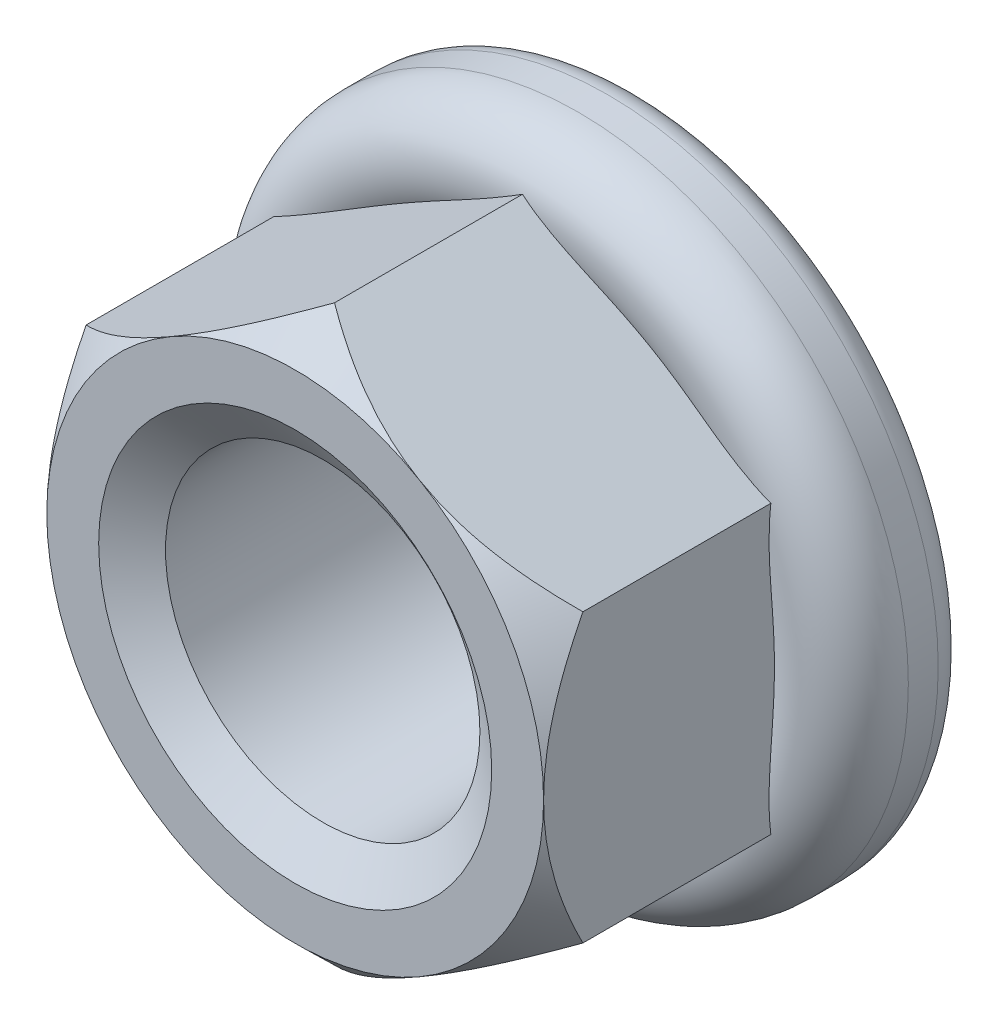
from build123d import *

# Parameters (mm, degrees)
BASENUTSKE_R  = 2.54
BASENUT_DEPTH = 5.5626


with BuildPart() as part:
    # BaseNutSke → BaseNut (new body)
    with BuildSketch(Plane.XY):
        Polygon((4.0132, 2.3170221), (4.0132, -2.3170221), (0, -4.634044201), (-4.0132, -2.3170221), (-4.0132, 2.3170221), (0, 4.634044201), align=None)
        Circle(BASENUTSKE_R, mode=Mode.SUBTRACT)
    extrude(amount=-BASENUT_DEPTH)

    # Sketch3 → Double-Chamfer (revolve, cut)
    with BuildSketch(Plane(origin=(0, 0, 0), x_dir=(0, 0, -1), z_dir=(1, 0, 0))):
        Polygon((0.635, 17.334044201), (-12.7, 17.334044201), (-12.7, 4.0132), (0, 4.0132), (0.635, 4.634044201), align=None)
    revolve(axis=Axis((0, 0, 0), (0, 0, -1)), mode=Mode.SUBTRACT)

    # EndChamferSke → EndChamfer (revolve, cut)
    with BuildSketch(Plane(origin=(0, 0, 0), x_dir=(0, 0, -1), z_dir=(1, 0, 0))):
        Polygon((5.5372, 3.175), (5.048105035, 2.4765), (5.588, 2.4765), (5.588, 3.175), align=None)
        Polygon((-0.0508, 3.175), (0, 3.175), (0.489094965, 2.4765), (-0.0508, 2.4765), align=None)
    revolve(axis=Axis((0, 0, -25.037505729), (0, 0, -1)), mode=Mode.SUBTRACT)

    # Sketch5 → Revolve1 (revolve)
    with BuildSketch(Plane(origin=(0, 0, 0), x_dir=(0, 0, -1), z_dir=(1, 0, 0))):
        with BuildLine():
            Line((5.5626, 3.47553315), (5.5626, 4.826))
            ThreePointArc((5.5626, 4.826), (5.413810245, 5.185210245), (5.0546, 5.334))
            Line((5.0546, 5.334), (4.572, 5.334))
            ThreePointArc((4.572, 5.334), (3.642766575, 4.404766575), (4.572, 3.47553315))
            Line((4.572, 3.47553315), (5.5626, 3.47553315))
        make_face()
    revolve(axis=Axis((0, 0, 4.49979694), (0, 0, -1)))


solid = part.part
